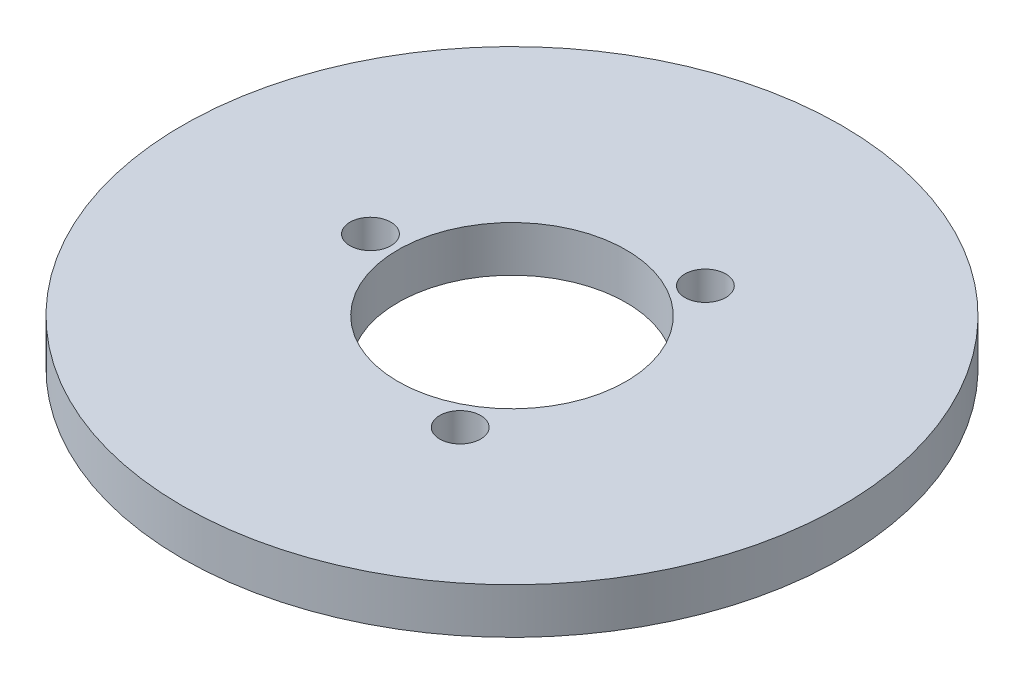
from build123d import *

# Parameters (mm, degrees)
SKETCH1_R           = 65
BOSS_EXTRUDE1_DEPTH = 9
SKETCH2_R           = 22.5
CUT_EXTRUDE1_DEPTH  = 93.36341267
SKETCH3_R           = 4.036606277
CUT_EXTRUDE2_DEPTH  = 8.879852711
CIRPATTERN1_COUNT   = 3


with BuildPart() as part:
    # Sketch1 → Boss-Extrude1 (new body)
    with BuildSketch(Plane(origin=(0, 0, 0), x_dir=(1, 0, 0), z_dir=(0, 1, 0))):
        Circle(SKETCH1_R)
    extrude(amount=BOSS_EXTRUDE1_DEPTH)

    # Sketch2 → Cut-Extrude1 (cut, through all)
    with BuildSketch(Plane(origin=(0, 0, 0), x_dir=(1, 0, 0), z_dir=(0, 1, 0))):
        Circle(SKETCH2_R)
    extrude(amount=CUT_EXTRUDE1_DEPTH, mode=Mode.SUBTRACT)

    # Sketch3 → Cut-Extrude2 (cut)
    with BuildSketch(Plane(origin=(0, 9, 0), x_dir=(1, 0, 0), z_dir=(0, 1, 0))):
        with Locations((-27.91704963, 0)):
            Circle(SKETCH3_R)
    cut_extrude2 = extrude(amount=-CUT_EXTRUDE2_DEPTH, mode=Mode.SUBTRACT)

    # CirPattern1: Cut-Extrude2 ×3 about axis
    cirpattern1_axis = Axis((0, 0, 0), (0, 1, 0))
    for i in range(1, CIRPATTERN1_COUNT):
        add(cut_extrude2.rotate(cirpattern1_axis, i * 360 / CIRPATTERN1_COUNT), mode=Mode.SUBTRACT)


solid = part.part
